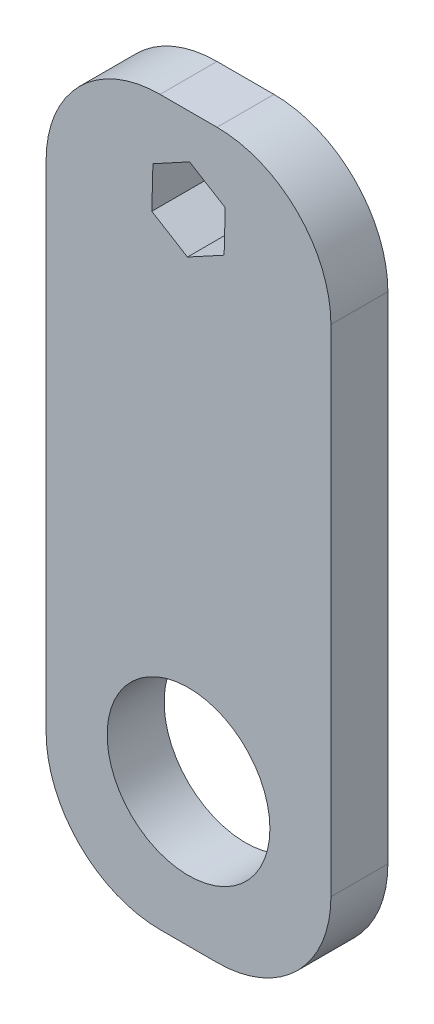
from build123d import *

# Parameters (mm, degrees)
SKETCH1_W           = 50
SKETCH1_H           = 10
BOSS_EXTRUDE1_DEPTH = 63.5
SKETCH2_R           = 14.2875
CUT_EXTRUDE1_DEPTH  = 127
FILLET1_R           = 20


with BuildPart() as part:
    # Sketch1 → Boss-Extrude1 (new, symmetric)
    with BuildSketch(Plane(origin=(0, 0, 0), x_dir=(1, 0, 0), z_dir=(0, 1, 0))):
        Rectangle(SKETCH1_W, SKETCH1_H)
    extrude(amount=BOSS_EXTRUDE1_DEPTH, both=True)

    # Sketch2 → Cut-Extrude1 (cut)
    with BuildSketch(Plane.XY.offset(5)):
        with Locations((0, -38.5)):
            Circle(SKETCH2_R)
        Polygon((6.252788981, 44.670383401), (6.442939752, 52.000265802), (0.190150771, 55.829882401), (-6.252788981, 52.329616599), (-6.442939752, 44.999734198), (-0.190150771, 41.170117599), align=None)
    extrude(amount=-CUT_EXTRUDE1_DEPTH, mode=Mode.SUBTRACT)

    # Fillet1
    fillet1_edges = [part.edges().sort_by_distance(p)[0] for p in [
        (-25, -63.5, 0),
        (25, -63.5, 0),
        (25, 63.5, 0),
        (-25, 63.5, 0),
    ]]
    fillet(fillet1_edges, radius=FILLET1_R)


solid = part.part
